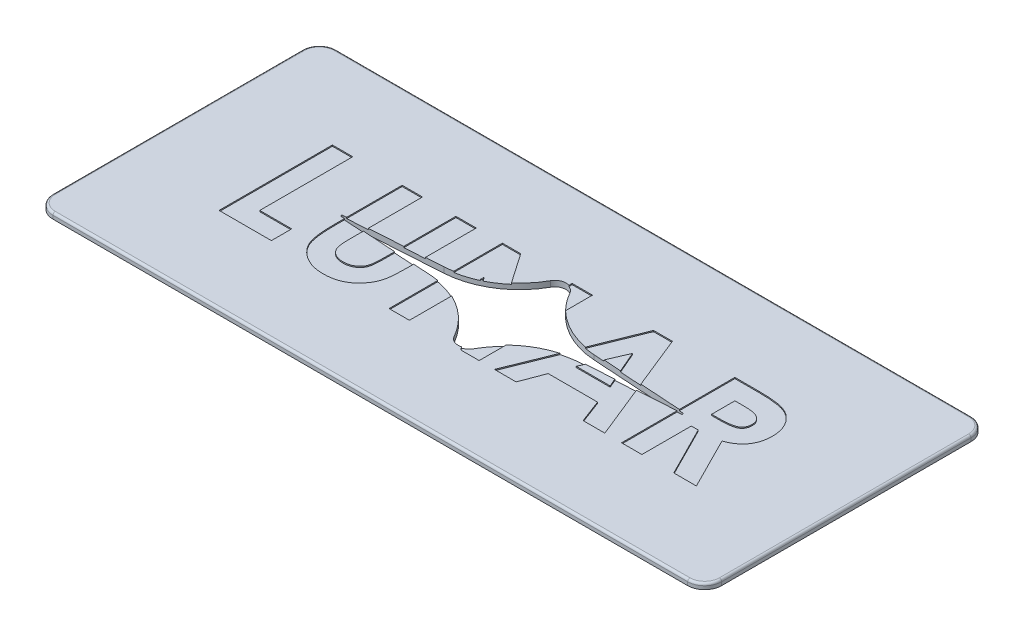
from build123d import *

# Parameters (mm, degrees)
SKETCH1_W           = 295
SKETCH1_H           = 125
BOSS_EXTRUDE1_DEPTH = 2.5
FILLET1_R           = 7.5
FILLET2_R           = 1
CUT_EXTRUDE4_DEPTH  = 10
CUT_EXTRUDE3_DEPTH  = 0.5


with BuildPart() as part:
    # Sketch1 → Boss-Extrude1 (new body)
    with BuildSketch(Plane(origin=(0, 0, 0), x_dir=(1, 0, 0), z_dir=(0, 1, 0))):
        Rectangle(SKETCH1_W, SKETCH1_H)
    extrude(amount=BOSS_EXTRUDE1_DEPTH)

    # Fillet1
    fillet1_edges = [part.edges().sort_by_distance(p)[0] for p in [
        (147.5, 1.25, 62.5),
        (-147.5, 1.25, 62.5),
        (147.5, 1.25, -62.5),
        (-147.5, 1.25, -62.5),
    ]]
    fillet(fillet1_edges, radius=FILLET1_R)

    # Fillet2
    fillet2_edges = [part.edges().sort_by_distance(p)[0] for p in [
        (145.303300859, 2.5, -60.303300859),
        (147.5, 2.5, 0),
        (145.303300859, 2.5, 60.303300859),
        (0, 2.5, 62.5),
        (-145.303300859, 2.5, 60.303300859),
        (-147.5, 2.5, 0),
        (-145.303300859, 2.5, -60.303300859),
        (0, 2.5, -62.5),
    ]]
    fillet(fillet2_edges, radius=FILLET2_R)

    # Sketch4 → Cut-Extrude4 (cut)
    with BuildSketch(Plane(origin=(0, 2.5, 0), x_dir=(1, 0, 0), z_dir=(0, 1, 0))):
        with BuildLine():
            Line((-33.073998348, 3.090010623), (-75.025380216, 0.395089537))
            ThreePointArc((-75.025380216, 0.395089537), (-75.3959039, 0), (-75.025380216, -0.395089537))
            Line((-75.025380216, -0.395089537), (-33.073998348, -3.090010623))
            ThreePointArc((-33.073998348, -3.090010623), (-16.332033074, -8.52386445), (-4.236704547, -21.311483324))
            ThreePointArc((-4.236704547, -21.311483324), (0, -23.802100242), (4.236704547, -21.311483324))
            ThreePointArc((4.236704547, -21.311483324), (16.332033074, -8.52386445), (33.073998348, -3.090010623))
            Line((33.073998348, -3.090010623), (75.025380216, -0.395089537))
            ThreePointArc((75.025380216, -0.395089537), (75.3959039, 0), (75.025380216, 0.395089537))
            Line((75.025380216, 0.395089537), (33.073998348, 3.090010623))
            ThreePointArc((33.073998348, 3.090010623), (16.332033074, 8.52386445), (4.236704547, 21.311483324))
            ThreePointArc((4.236704547, 21.311483324), (0, 23.802100242), (-4.236704547, 21.311483324))
            ThreePointArc((-4.236704547, 21.311483324), (-16.332033074, 8.52386445), (-33.073998348, 3.090010623))
        make_face()
    extrude(amount=-CUT_EXTRUDE4_DEPTH, mode=Mode.SUBTRACT)

    # Sketch3 → Cut-Extrude3 (cut)
    # profile 1 of 5: a face of its own
    with BuildSketch(Plane(origin=(0, 2.5, 0), x_dir=(1, 0, 0), z_dir=(0, 1, 0))):
        Polygon((-104.230769231, 25), (-95.256410256, 25), (-95.256410256, -16.025641026), (-81.153846154, -16.025641026), (-81.153846154, -25), (-104.230769231, -25), align=None)
    # profile 2 of 5: a face of its own
    with BuildSketch(Plane(origin=(0, 2.5, 0), x_dir=(1, 0, 0), z_dir=(0, 1, 0))):
        with BuildLine():
            Line((-73.461538462, 25), (-64.487179487, 25))
            Line((-64.487179487, 25), (-64.487179487, -7.532051282))
            add(Edge.make_bspline(
                [(-64.487179487, -7.532051282), (-64.486691506, -7.869329479), (-64.485748975, -8.520778833), (-64.438565382, -9.455395369), (-64.395389141, -10.314503653), (-64.317486947, -11.097163146), (-64.202398705, -11.803708642), (-64.090955734, -12.438678737), (-63.940128692, -12.99070501), (-63.713459761, -13.619055433), (-63.364237348, -14.325041454), (-62.793627301, -15.060836281), (-62.135192122, -15.732355857), (-61.346019635, -16.291303309), (-60.459059552, -16.743441418), (-59.479185323, -17.07842572), (-58.407778224, -17.264632514), (-57.666958986, -17.293060392), (-57.285657051, -17.307692308)],
                knots=[0, 0, 0, 0, 1.155499968, 2.231836252, 3.205919964, 4.102923608, 4.924856345, 5.658536265, 6.31071849, 6.882491295, 7.94666036, 8.992281882, 10.060072772, 11.158554251, 12.289267114, 13.461410017, 14.693379945, 16, 16, 16, 16], degree=3))
            add(Edge.make_bspline(
                [(-57.285657051, -17.307692308), (-56.8805708, -17.295871598), (-56.090721193, -17.272823215), (-54.954648275, -17.046578387), (-53.902070273, -16.686319137), (-52.955273854, -16.172137374), (-52.115201233, -15.555800417), (-51.404097362, -14.852983146), (-50.842896799, -14.062283789), (-50.477127152, -13.33280342), (-50.271765507, -12.661380266), (-50.117836725, -12.061489155), (-50.004989898, -11.353677025), (-49.902611548, -10.54899789), (-49.841090047, -9.63911682), (-49.774380008, -8.6313512), (-49.74993016, -7.518805626), (-49.745762861, -6.744119263), (-49.743589744, -6.340144231)],
                knots=[0, 0, 0, 0, 1.261321664, 2.459363699, 3.594844139, 4.716940403, 5.803436589, 6.833651888, 7.818396249, 8.814403945, 9.360733334, 10.004355033, 10.743453831, 11.592799886, 12.532235708, 13.585170094, 14.740740724, 16, 16, 16, 16], degree=3))
            Line((-49.743589744, -6.340144231), (-49.743589744, 25))
            Line((-49.743589744, 25), (-40.769230769, 25))
            Line((-40.769230769, 25), (-40.769230769, -4.827724359))
            add(Edge.make_bspline(
                [(-40.769230769, -4.827724359), (-40.770477022, -5.432032629), (-40.772873445, -6.594058496), (-40.809675273, -8.263971441), (-40.888019708, -9.789169051), (-40.953819997, -11.170096983), (-41.081166089, -12.404894901), (-41.213830843, -13.498835742), (-41.382923486, -14.44804283), (-41.63452317, -15.528599746), (-42.068709741, -16.772821461), (-42.768675416, -18.20548883), (-43.657236535, -19.608156965), (-44.707471372, -20.965395549), (-45.893282571, -22.226226454), (-47.188378159, -23.333072789), (-48.572182287, -24.269345433), (-50.059154717, -25.012151393), (-51.648029958, -25.591484043), (-53.354528745, -25.980766404), (-55.177487381, -26.243770454), (-56.436639367, -26.26903523), (-57.085336538, -26.282051282)],
                knots=[0, 0, 0, 0, 1.170808336, 2.251350247, 3.235597562, 4.129743112, 4.929140599, 5.639994148, 6.264258765, 6.79612947, 7.788252245, 8.809469599, 9.879094798, 10.999557536, 12.129761673, 13.226370002, 14.293821979, 15.358369427, 16.438775801, 17.562147481, 18.744053101, 20, 20, 20, 20], degree=3))
            add(Edge.make_bspline(
                [(-57.085336538, -26.282051282), (-57.516343844, -26.274791533), (-58.366712416, -26.260468198), (-59.617328582, -26.134173793), (-60.826294775, -25.948063328), (-61.991339356, -25.676547326), (-63.116505977, -25.325799364), (-64.201495708, -24.894053049), (-65.242276465, -24.383716608), (-66.233024185, -23.799484032), (-67.172519667, -23.167737074), (-68.031170042, -22.467418977), (-68.838523485, -21.750320909), (-69.571255892, -20.986264341), (-70.234870735, -20.183270561), (-70.828001298, -19.339519725), (-71.349766387, -18.455086775), (-71.813290718, -17.514029862), (-72.210022304, -16.468518459), (-72.544481936, -15.281363295), (-72.83667374, -13.933956898), (-73.053813449, -12.423263633), (-73.250673584, -10.754262578), (-73.375275195, -8.922605728), (-73.440459907, -6.928240534), (-73.454334738, -5.54558849), (-73.461538462, -4.827724359)],
                knots=[0, 0, 0, 0, 1.001158378, 1.975264943, 2.917723546, 3.841610987, 4.75185031, 5.653588123, 6.552117133, 7.442167995, 8.324307438, 9.179605724, 10.014504199, 10.831958861, 11.636465792, 12.43274043, 13.225645099, 14.020104002, 14.867201867, 15.819789774, 16.883317127, 18.068162734, 19.364263498, 20.787406516, 22.332041935, 24, 24, 24, 24], degree=3))
            Line((-73.461538462, -4.827724359), (-73.461538462, 25))
        make_face()
    # profile 3 of 5: a face of its own
    with BuildSketch(Plane(origin=(0, 2.5, 0), x_dir=(1, 0, 0), z_dir=(0, 1, 0))):
        Polygon((-29.230769231, 25), (-21.147836538, 25), (1.538461538, -7.902644231), (1.538461538, 25), (10.512820513, 25), (10.512820513, -25), (2.369791667, -25), (-20.256410256, 7.802483974), (-20.256410256, -25), (-29.230769231, -25), align=None)
    # profile 4 of 5: a face of its own
    with BuildSketch(Plane(origin=(0, 2.5, 0), x_dir=(1, 0, 0), z_dir=(0, 1, 0))):
        Polygon((37.445913462, 25), (45.769230769, 25), (65.961538462, -25), (56.376201923, -25), (52.489983974, -14.743589744), (30.705128205, -14.743589744), (26.818910256, -25), (17.243589744, -25), align=None)
        Polygon((41.602564103, 11.588541667), (34.110576923, -5.769230769), (49.094551282, -5.769230769), align=None, mode=Mode.SUBTRACT)
    # profile 5 of 5: a face of its own
    with BuildSketch(Plane(origin=(0, 2.5, 0), x_dir=(1, 0, 0), z_dir=(0, 1, 0))):
        with BuildLine():
            Line((73.333333333, 25), (83.790064103, 25))
            add(Edge.make_bspline(
                [(83.790064103, 25), (84.481250823, 24.997546684), (85.810597585, 24.992828266), (87.727443007, 24.918384127), (89.488329136, 24.814788998), (91.095863124, 24.656700081), (92.549357241, 24.447093287), (93.850268228, 24.200001562), (94.99855806, 23.918387566), (96.003910977, 23.567474309), (96.91119227, 23.171649475), (97.756904572, 22.716839483), (98.559705553, 22.208108785), (99.314229356, 21.6320713), (100.02703297, 20.999089801), (100.699461142, 20.30852713), (101.322011838, 19.554527598), (101.8908302, 18.741855528), (102.409262349, 17.886943145), (102.867447636, 16.98861665), (103.240044672, 16.046251317), (103.569274095, 15.073466362), (103.806407383, 14.056355632), (103.971330116, 13.004820874), (104.092080089, 11.915160572), (104.099022635, 11.174893743), (104.102564103, 10.797275641)],
                knots=[0, 0, 0, 0, 1.749336639, 3.364467119, 4.854658419, 6.213483162, 7.451590619, 8.570285859, 9.5643256, 10.440900261, 11.26203566, 12.067320669, 12.869050712, 13.665104639, 14.467235401, 15.27997916, 16.102287765, 16.939272006, 17.78853747, 18.631303466, 19.488103222, 20.351255419, 21.228522269, 22.127379805, 23.044756219, 24, 24, 24, 24], degree=3))
            add(Edge.make_bspline(
                [(104.102564103, 10.797275641), (104.093364643, 10.40312909), (104.075326179, 9.630279539), (103.9781612, 8.495026583), (103.800574141, 7.408895962), (103.531592704, 6.375067733), (103.22243348, 5.380674699), (102.811331016, 4.444064032), (102.347361253, 3.551614088), (101.796317922, 2.715948909), (101.191574786, 1.918506703), (100.488271241, 1.189840437), (99.731970551, 0.490787061), (98.880158303, -0.134867096), (97.97038317, -0.729426505), (96.984568879, -1.268255667), (95.92914919, -1.764899506), (95.187136881, -2.041862417), (94.807692308, -2.18349359)],
                knots=[0, 0, 0, 0, 1.099860209, 2.156625411, 3.176576793, 4.16617041, 5.135385252, 6.078461593, 7.016046972, 7.938469504, 8.868247731, 9.803980173, 10.76021508, 11.73834243, 12.748633912, 13.790971185, 14.870363756, 16, 16, 16, 16], degree=3))
            Line((94.807692308, -2.18349359), (106.346153846, -25))
            Line((106.346153846, -25), (96.370192308, -25))
            Line((96.370192308, -25), (85.352564103, -3.205128205))
            Line((85.352564103, -3.205128205), (82.307692308, -3.205128205))
            Line((82.307692308, -3.205128205), (82.307692308, -25))
            Line((82.307692308, -25), (73.333333333, -25))
            Line((73.333333333, -25), (73.333333333, 25))
        make_face()
        with BuildLine():
            Line((82.307692308, 5.769230769), (85.803285256, 5.769230769))
            add(Edge.make_bspline(
                [(85.803285256, 5.769230769), (86.230650552, 5.774044044), (87.048963262, 5.783260432), (88.225804419, 5.826009859), (89.29465685, 5.929014853), (90.26011057, 6.059157813), (91.127023654, 6.209426655), (91.887663542, 6.42477103), (92.553750536, 6.655517978), (93.117391478, 6.942276579), (93.598953347, 7.268383303), (94.0147512, 7.638848648), (94.358675642, 8.067615113), (94.641743, 8.543030675), (94.861938629, 9.069300266), (95.02266457, 9.640646641), (95.112486602, 10.263578168), (95.122820933, 10.693485742), (95.128205128, 10.917467949)],
                knots=[0, 0, 0, 0, 1.688639943, 3.233382647, 4.650958383, 5.928841754, 7.082724185, 8.122798841, 9.049171256, 9.863274652, 10.613301712, 11.341792392, 12.054588806, 12.776240173, 13.521029143, 14.301969904, 15.115324896, 16, 16, 16, 16], degree=3))
            add(Edge.make_bspline(
                [(95.128205128, 10.917467949), (95.118025814, 11.182455251), (95.098030438, 11.7029737), (94.899614189, 12.452337752), (94.583778379, 13.145925451), (94.150853989, 13.780602999), (93.605642004, 14.33700515), (92.979968236, 14.827478077), (92.260329133, 15.215307369), (91.593997478, 15.47111544), (90.987791421, 15.624168048), (90.440709581, 15.738221498), (89.807185515, 15.819054452), (89.086740949, 15.904792187), (88.28121232, 15.960388769), (87.386209015, 16.000963192), (86.404301477, 16.017564182), (85.719818666, 16.022871225), (85.362580128, 16.025641026)],
                knots=[0, 0, 0, 0, 1.020303359, 2.004196876, 2.966617323, 3.9489082, 4.950758222, 5.960522915, 7.003732012, 8.091992268, 8.70421221, 9.413913587, 10.24622431, 11.166358409, 12.212345909, 13.359657661, 14.621978493, 16, 16, 16, 16], degree=3))
            Line((85.362580128, 16.025641026), (82.307692308, 16.025641026))
            Line((82.307692308, 16.025641026), (82.307692308, 5.769230769))
        make_face(mode=Mode.SUBTRACT)
    extrude(amount=-CUT_EXTRUDE3_DEPTH, mode=Mode.SUBTRACT)


solid = part.part
